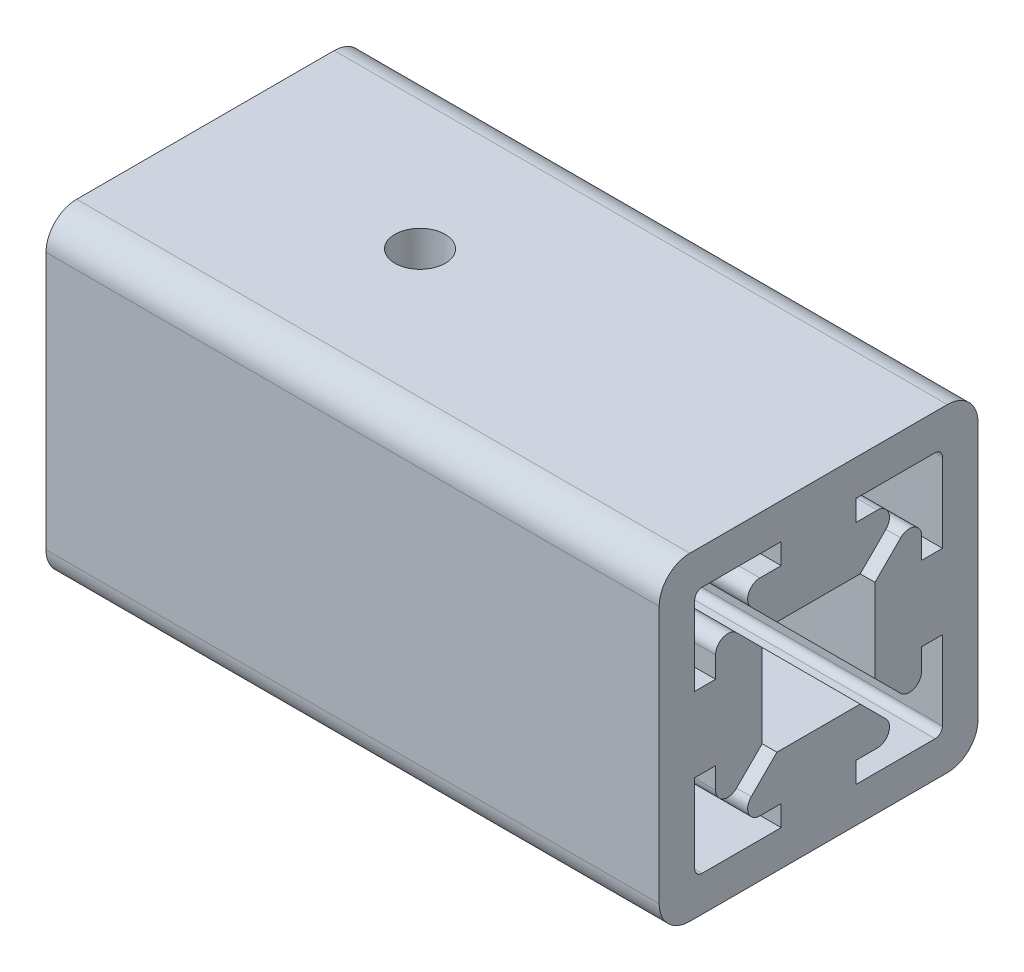
from build123d import *

# Parameters (mm, degrees)
BOSS_EXTRUDE1_DEPTH      = 39
BOSS_EXTRUDE1_DEPTH_BACK = 10
SKETCH1_W                = 42
SKETCH1_H                = 40
CUT_EXTRUDE3_DEPTH       = 68.939361812
CUT_EXTRUDE3_DEPTH_BACK  = 68.939361812
BOSS_EXTRUDE2_DEPTH      = 40
CUT_EXTRUDE7_START       = -10
SKETCH7_R                = 2.05
CUT_EXTRUDE7_DEPTH       = 116.132850877
CUT_EXTRUDE8_DEPTH       = 3.125
SKETCH9_R                = 2.778089848
BOSS_EXTRUDE3_DEPTH      = 6
CIRPATTERN1_COUNT        = 2
SKETCH10_W               = 6.985924482
SKETCH10_H               = 7.120269183
CUT_EXTRUDE13_DEPTH      = 8
SKETCH14_OUTSIDE_W       = 59.316
SKETCH14_OUTSIDE_H       = 57.316
CUT_EXTRUDE14_DEPTH      = 111.429494292
CHAMFER1_SIZE            = 5.5


with BuildPart() as part:
    # Sketch1 → Boss-Extrude1 (new, two sides: drawn at the far end of the back side and taken through both)
    with BuildSketch(Plane.ZY.offset(-BOSS_EXTRUDE1_DEPTH_BACK)):
        with Locations((70.454449321, -16.479540615)):
            Rectangle(SKETCH1_W, SKETCH1_H)
        with BuildLine():
            Line((77.147342539, -21.970352305), (75.054449321, -19.877459087))
            Line((75.054449321, -19.877459087), (75.054449321, -13.081622143))
            Line((75.054449321, -13.081622143), (77.147342539, -10.988728924))
            ThreePointArc((77.147342539, -10.988728924), (78.237132753, -10.771956173), (78.854449321, -11.695835705))
            Line((78.854449321, -11.695835705), (78.854449321, -13.429540615))
            Line((78.854449321, -13.429540615), (80.554449321, -13.429540615))
            Line((80.554449321, -13.429540615), (80.554449321, -6.979540615))
            ThreePointArc((80.554449321, -6.979540615), (80.378713389, -6.555276546), (79.954449321, -6.379540615))
            Line((79.954449321, -6.379540615), (73.504449321, -6.379540615))
            Line((73.504449321, -6.379540615), (73.504449321, -8.079540615))
            Line((73.504449321, -8.079540615), (75.23815423, -8.079540615))
            ThreePointArc((75.23815423, -8.079540615), (76.162033763, -8.696857182), (75.945261011, -9.786647396))
            Line((75.945261011, -9.786647396), (73.852367793, -11.879540615))
            Line((73.852367793, -11.879540615), (67.056530849, -11.879540615))
            Line((67.056530849, -11.879540615), (64.96363763, -9.786647396))
            ThreePointArc((64.96363763, -9.786647396), (64.746864878, -8.696857182), (65.670744411, -8.079540615))
            Line((65.670744411, -8.079540615), (67.404449321, -8.079540615))
            Line((67.404449321, -8.079540615), (67.404449321, -6.379540615))
            Line((67.404449321, -6.379540615), (60.954449321, -6.379540615))
            ThreePointArc((60.954449321, -6.379540615), (60.530185252, -6.555276546), (60.354449321, -6.979540615))
            Line((60.354449321, -6.979540615), (60.354449321, -13.429540615))
            Line((60.354449321, -13.429540615), (62.054449321, -13.429540615))
            Line((62.054449321, -13.429540615), (62.054449321, -11.695835705))
            ThreePointArc((62.054449321, -11.695835705), (62.671765888, -10.771956173), (63.761556102, -10.988728924))
            Line((63.761556102, -10.988728924), (65.854449321, -13.081622143))
            Line((65.854449321, -13.081622143), (65.854449321, -19.877459087))
            Line((65.854449321, -19.877459087), (63.761556102, -21.970352305))
            ThreePointArc((63.761556102, -21.970352305), (62.671765888, -22.187125057), (62.054449321, -21.263245524))
            Line((62.054449321, -21.263245524), (62.054449321, -19.529540615))
            Line((62.054449321, -19.529540615), (60.354449321, -19.529540615))
            Line((60.354449321, -19.529540615), (60.354449321, -25.979540615))
            ThreePointArc((60.354449321, -25.979540615), (60.530185252, -26.403804683), (60.954449321, -26.579540615))
            Line((60.954449321, -26.579540615), (67.404449321, -26.579540615))
            Line((67.404449321, -26.579540615), (67.404449321, -24.879540615))
            Line((67.404449321, -24.879540615), (65.670744411, -24.879540615))
            ThreePointArc((65.670744411, -24.879540615), (64.746864878, -24.262224047), (64.96363763, -23.172433833))
            Line((64.96363763, -23.172433833), (67.056530849, -21.079540615))
            Line((67.056530849, -21.079540615), (73.852367793, -21.079540615))
            Line((73.852367793, -21.079540615), (75.945261011, -23.172433833))
            ThreePointArc((75.945261011, -23.172433833), (76.162033763, -24.262224047), (75.23815423, -24.879540615))
            Line((75.23815423, -24.879540615), (73.504449321, -24.879540615))
            Line((73.504449321, -24.879540615), (73.504449321, -26.579540615))
            Line((73.504449321, -26.579540615), (79.954449321, -26.579540615))
            ThreePointArc((79.954449321, -26.579540615), (80.378713389, -26.403804683), (80.554449321, -25.979540615))
            Line((80.554449321, -25.979540615), (80.554449321, -19.529540615))
            Line((80.554449321, -19.529540615), (78.854449321, -19.529540615))
            Line((78.854449321, -19.529540615), (78.854449321, -21.263245524))
            ThreePointArc((78.854449321, -21.263245524), (78.237132753, -22.187125057), (77.147342539, -21.970352305))
        make_face(mode=Mode.SUBTRACT)
    extrude(amount=BOSS_EXTRUDE1_DEPTH + BOSS_EXTRUDE1_DEPTH_BACK)

    # Sketch2 → Cut-Extrude3 (cut, two sides: drawn at the far end of the back side and taken through both)
    with BuildSketch(Plane(origin=(0, 0, 91.454449321), x_dir=(-1, 0, 0), z_dir=(0, 0, -1)).offset(-CUT_EXTRUDE3_DEPTH_BACK)):
        with BuildLine():
            Line((9, 3.520459385), (39, 3.520459385))
            Line((39, 3.520459385), (39, -36.479540615))
            Line((39, -36.479540615), (30.968670474, -36.479540615))
            ThreePointArc((30.968670474, -36.479540615), (30.884335237, -36.480014542), (30.8, -36.479540615))
            Line((30.8, -36.479540615), (30.8, -37.552822487))
            Line((30.8, -37.552822487), (41.446354872, -37.552822487))
            Line((41.446354872, -37.552822487), (41.446354872, 6.899861608))
            Line((41.446354872, 6.899861608), (9, 6.899861608))
            Line((9, 6.899861608), (9, 3.520459385))
        make_face()
        with BuildLine():
            Line((39, -36.479540615), (39, 3.520459385))
            Line((39, 3.520459385), (9, 3.520459385))
            Line((9, 3.520459385), (36.19042941, -23.669970025))
            ThreePointArc((36.19042941, -23.669970025), (37.833109012, -31.808697916), (30.968670474, -36.479540615))
            Line((30.968670474, -36.479540615), (39, -36.479540615))
        make_face()
    extrude(amount=CUT_EXTRUDE3_DEPTH + CUT_EXTRUDE3_DEPTH_BACK, mode=Mode.SUBTRACT)

    # Sketch4 → Boss-Extrude2 (add)
    with BuildSketch(Plane(origin=(0, 0, 0), x_dir=(0, 0, -1), z_dir=(1, 0, 0))):
        with BuildLine():
            Line((-80.954449321, -3.479540615), (-59.954449321, -3.479540615))
            ThreePointArc((-59.954449321, -3.479540615), (-58.186682368, -4.211773662), (-57.454449321, -5.979540615))
            Line((-57.454449321, -5.979540615), (-57.454449321, -26.979540615))
            ThreePointArc((-57.454449321, -26.979540615), (-58.186682368, -28.747307568), (-59.954449321, -29.479540615))
            Line((-59.954449321, -29.479540615), (-80.954449321, -29.479540615))
            ThreePointArc((-80.954449321, -29.479540615), (-82.722216274, -28.747307568), (-83.454449321, -26.979540615))
            Line((-83.454449321, -26.979540615), (-83.454449321, -5.979540615))
            ThreePointArc((-83.454449321, -5.979540615), (-82.722216274, -4.211773662), (-80.954449321, -3.479540615))
        make_face()
        with BuildLine():
            Line((-62.054449321, -11.695835705), (-62.054449321, -13.429540615))
            Line((-62.054449321, -13.429540615), (-60.354449321, -13.429540615))
            Line((-60.354449321, -13.429540615), (-60.354449321, -6.979540615))
            ThreePointArc((-60.354449321, -6.979540615), (-60.530185252, -6.555276546), (-60.954449321, -6.379540615))
            Line((-60.954449321, -6.379540615), (-67.404449321, -6.379540615))
            Line((-67.404449321, -6.379540615), (-67.404449321, -8.079540615))
            Line((-67.404449321, -8.079540615), (-65.670744411, -8.079540615))
            ThreePointArc((-65.670744411, -8.079540615), (-64.746864878, -8.696857182), (-64.96363763, -9.786647396))
            Line((-64.96363763, -9.786647396), (-67.056530849, -11.879540615))
            Line((-67.056530849, -11.879540615), (-73.852367793, -11.879540615))
            Line((-73.852367793, -11.879540615), (-75.945261011, -9.786647396))
            ThreePointArc((-75.945261011, -9.786647396), (-76.162033763, -8.696857182), (-75.23815423, -8.079540615))
            Line((-75.23815423, -8.079540615), (-73.504449321, -8.079540615))
            Line((-73.504449321, -8.079540615), (-73.504449321, -6.379540615))
            Line((-73.504449321, -6.379540615), (-79.954449321, -6.379540615))
            ThreePointArc((-79.954449321, -6.379540615), (-80.378713389, -6.555276546), (-80.554449321, -6.979540615))
            Line((-80.554449321, -6.979540615), (-80.554449321, -13.429540615))
            Line((-80.554449321, -13.429540615), (-78.854449321, -13.429540615))
            Line((-78.854449321, -13.429540615), (-78.854449321, -11.695835705))
            ThreePointArc((-78.854449321, -11.695835705), (-78.237132753, -10.771956173), (-77.147342539, -10.988728924))
            Line((-77.147342539, -10.988728924), (-75.054449321, -13.081622143))
            Line((-75.054449321, -13.081622143), (-75.054449321, -19.877459087))
            Line((-75.054449321, -19.877459087), (-77.147342539, -21.970352305))
            ThreePointArc((-77.147342539, -21.970352305), (-78.237132753, -22.187125057), (-78.854449321, -21.263245524))
            Line((-78.854449321, -21.263245524), (-78.854449321, -19.529540615))
            Line((-78.854449321, -19.529540615), (-80.554449321, -19.529540615))
            Line((-80.554449321, -19.529540615), (-80.554449321, -25.979540615))
            ThreePointArc((-80.554449321, -25.979540615), (-80.378713389, -26.403804683), (-79.954449321, -26.579540615))
            Line((-79.954449321, -26.579540615), (-73.504449321, -26.579540615))
            Line((-73.504449321, -26.579540615), (-73.504449321, -24.879540615))
            Line((-73.504449321, -24.879540615), (-75.23815423, -24.879540615))
            ThreePointArc((-75.23815423, -24.879540615), (-76.162033763, -24.262224047), (-75.945261011, -23.172433833))
            Line((-75.945261011, -23.172433833), (-73.852367793, -21.079540615))
            Line((-73.852367793, -21.079540615), (-67.056530849, -21.079540615))
            Line((-67.056530849, -21.079540615), (-64.96363763, -23.172433833))
            ThreePointArc((-64.96363763, -23.172433833), (-64.746864878, -24.262224047), (-65.670744411, -24.879540615))
            Line((-65.670744411, -24.879540615), (-67.404449321, -24.879540615))
            Line((-67.404449321, -24.879540615), (-67.404449321, -26.579540615))
            Line((-67.404449321, -26.579540615), (-60.954449321, -26.579540615))
            ThreePointArc((-60.954449321, -26.579540615), (-60.530185252, -26.403804683), (-60.354449321, -25.979540615))
            Line((-60.354449321, -25.979540615), (-60.354449321, -19.529540615))
            Line((-60.354449321, -19.529540615), (-62.054449321, -19.529540615))
            Line((-62.054449321, -19.529540615), (-62.054449321, -21.263245524))
            ThreePointArc((-62.054449321, -21.263245524), (-62.671765888, -22.187125057), (-63.761556102, -21.970352305))
            Line((-63.761556102, -21.970352305), (-65.854449321, -19.877459087))
            Line((-65.854449321, -19.877459087), (-65.854449321, -13.081622143))
            Line((-65.854449321, -13.081622143), (-63.761556102, -10.988728924))
            ThreePointArc((-63.761556102, -10.988728924), (-62.671765888, -10.771956173), (-62.054449321, -11.695835705))
        make_face(mode=Mode.SUBTRACT)
    extrude(amount=-BOSS_EXTRUDE2_DEPTH)

    # Sketch7 → Cut-Extrude7 (cut)
    with BuildSketch(Plane(origin=(0, -3.479540615, 0), x_dir=(1, 0, 0), z_dir=(0, 1, 0)).offset(CUT_EXTRUDE7_START)):
        with Locations(Location((-22.5, -70.454449321, 0), (0, 0, 270))):
            Circle(SKETCH7_R)
    cut_extrude7 = extrude(amount=CUT_EXTRUDE7_DEPTH, mode=Mode.SUBTRACT)

    # Sketch8 → Cut-Extrude8 (cut, symmetric)
    with BuildSketch(Plane.ZY.offset(22.5)):
        Polygon((60.954449321, -6.379540615), (79.954449321, -6.379540615), (70.690797066, -16.49195704), align=None)
        Polygon((70.690797066, -16.49195704), (60.954449321, -26.579540615), (79.954449321, -26.579540615), align=None)
    extrude(amount=CUT_EXTRUDE8_DEPTH, both=True, mode=Mode.SUBTRACT)

    # CirPattern1: Cut-Extrude7 ×2 about axis
    cirpattern1_axis = Axis((-34, -16.479540615, 70.454449321), (-1, 0, 0))
    for i in range(1, CIRPATTERN1_COUNT):
        add(cut_extrude7.rotate(cirpattern1_axis, i * 360 / CIRPATTERN1_COUNT), mode=Mode.SUBTRACT)

    # Sketch14 outside → Cut-Extrude14 (cut, through all)
    with BuildSketch(Plane.ZY.offset(40)):
        with Locations((70.454, -16.48)):
            Rectangle(SKETCH14_OUTSIDE_W, SKETCH14_OUTSIDE_H)
        with BuildLine():
            Line((59.954449321, -29.479540615), (80.954449321, -29.479540615))
            ThreePointArc((80.954449321, -29.479540615), (82.722216274, -28.747307568), (83.454449321, -26.979540615))
            Line((83.454449321, -26.979540615), (83.454449321, -5.979540615))
            ThreePointArc((83.454449321, -5.979540615), (82.722216274, -4.211773662), (80.954449321, -3.479540615))
            Line((80.954449321, -3.479540615), (59.954449321, -3.479540615))
            ThreePointArc((59.954449321, -3.479540615), (58.186682368, -4.211773662), (57.454449321, -5.979540615))
            Line((57.454449321, -5.979540615), (57.454449321, -26.979540615))
            ThreePointArc((57.454449321, -26.979540615), (58.186682368, -28.747307568), (59.954449321, -29.479540615))
        make_face(mode=Mode.SUBTRACT)
    extrude(amount=-CUT_EXTRUDE14_DEPTH, mode=Mode.SUBTRACT)

    # Chamfer1
    chamfer1_edges = [part.edges().sort_by_distance(p)[0] for p in [
        (-25.625, -11.879540615, 70.454449321),
        (-25.625, -21.079540615, 70.454449321),
    ]]
    chamfer(chamfer1_edges, length=CHAMFER1_SIZE - 0.0001)  # a hair under: the kernel refuses the full size


with BuildPart() as body_2:
    # Sketch9 → Boss-Extrude3 (new body)
    with BuildSketch(Plane.ZY.offset(40)):
        with Locations((70.454449321, -16.479540615)):
            Circle(SKETCH9_R)
    extrude(amount=-BOSS_EXTRUDE3_DEPTH)

    # Sketch10 → Cut-Extrude13 (cut, symmetric)
    with BuildSketch(Plane.ZY.offset(40)):
        with Locations((70.605937199, -16.255142793)):
            Rectangle(SKETCH10_W, SKETCH10_H)
    extrude(amount=CUT_EXTRUDE13_DEPTH, both=True, mode=Mode.SUBTRACT)


solid = part.part
